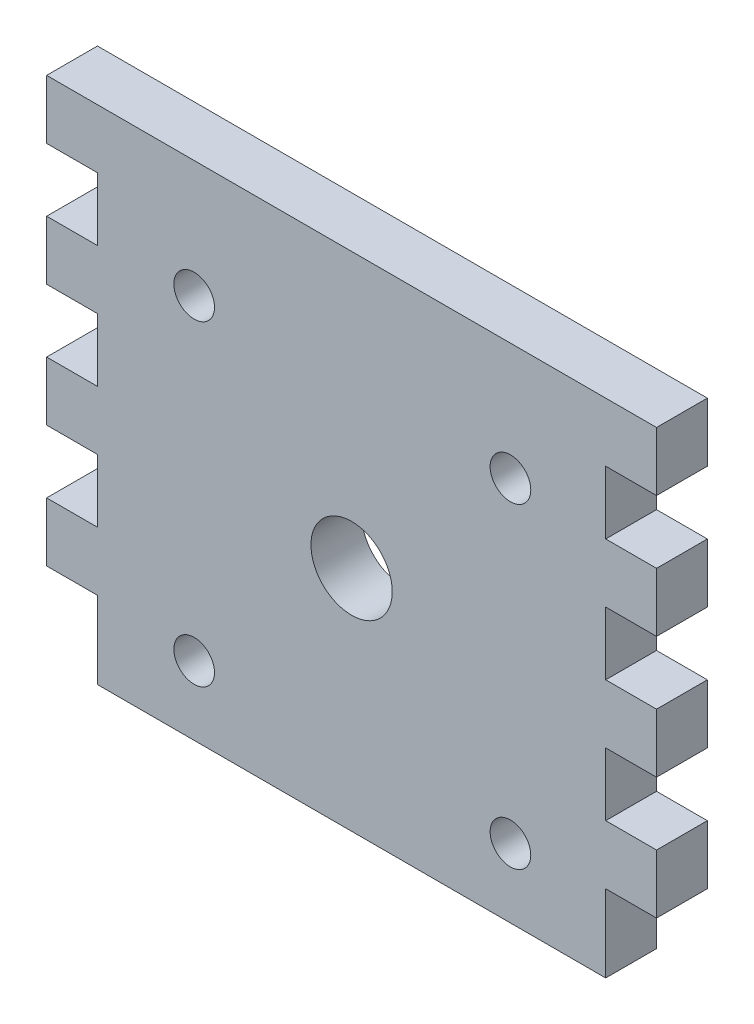
from build123d import *

# Parameters (mm, degrees)
SKETCH1_W           = 76.2
SKETCH1_H           = 76.2
BOSS_EXTRUDE1_DEPTH = 6.35
CUT_EXTRUDE1_DEPTH  = 6.35
SKETCH3_W           = 6.35
SKETCH3_H           = 38.1
CUT_EXTRUDE2_DEPTH  = 6.35
SKETCH4_W           = 6.35
SKETCH4_H           = 7.62
BOSS_EXTRUDE3_DEPTH = 6.35
SKETCH5_W           = 63.5
SKETCH5_H           = 6.35
CUT_EXTRUDE3_DEPTH  = 7.62
SKETCH6_R           = 5.08
SKETCH6_R_2         = 2.54
CUT_EXTRUDE4_DEPTH  = 71.769022866
SKETCH7_W           = 6.35
SKETCH7_H           = 7.62
BOSS_EXTRUDE4_DEPTH = 6.35
SKETCH9_W           = 63.5
SKETCH9_H           = 5.835909299
CUT_EXTRUDE5_DEPTH  = 6.35
SKETCH10_W          = 6.35
SKETCH10_H          = 6.35
BOSS_EXTRUDE5_DEPTH = 55.118
SKETCH11_W          = 6.35
SKETCH11_H          = 6.35
BOSS_EXTRUDE6_DEPTH = 55.118
CUT_EXTRUDE7_DEPTH  = 55.118
SKETCH13_W          = 6.35
SKETCH13_H          = 6.35
CUT_EXTRUDE8_DEPTH  = 55.118


with BuildPart() as part:
    # Sketch1 → Boss-Extrude1 (new body)
    with BuildSketch(Plane.XY):
        with Locations((0.21991342, -21.056709957)):
            Rectangle(SKETCH1_W, SKETCH1_H)
    extrude(amount=BOSS_EXTRUDE1_DEPTH)

    # Sketch2 → Cut-Extrude1 (cut)
    with BuildSketch(Plane.XY.offset(6.35)):
        Polygon((-37.88008658, 17.043290043), (-31.53008658, 17.043290043), (-31.53008658, 9.423290043), (-37.88008658, 9.423290043), (-37.88008658, 1.803290043), (-31.53008658, 1.803290043), (-31.53008658, -5.816709957), (-37.88008658, -5.816709957), (-37.88008658, -13.436709957), (-31.53008658, -13.436709957), (-31.53008658, -21.056709957), (-37.88008658, -21.056709957), (-46.725849744, -21.056709957), (-46.725849744, 17.043290043), align=None)
        Polygon((47.165676584, -21.056709957), (47.165676584, 17.043290043), (38.31991342, 17.043290043), (31.96991342, 17.043290043), (31.96991342, 9.423290043), (38.31991342, 9.423290043), (38.31991342, 1.803290043), (31.96991342, 1.803290043), (31.96991342, -5.816709957), (38.31991342, -5.816709957), (38.31991342, -13.436709957), (31.96991342, -13.436709957), (31.96991342, -21.056709957), (38.31991342, -21.056709957), align=None)
    extrude(amount=-CUT_EXTRUDE1_DEPTH, mode=Mode.SUBTRACT)

    # Sketch3 → Cut-Extrude2 (cut)
    with BuildSketch(Plane.XY.offset(6.35)):
        with Locations((-34.70508658, -40.106709957)):
            Rectangle(SKETCH3_W, SKETCH3_H)
        with Locations((35.14491342, -40.106709957)):
            Rectangle(SKETCH3_W, SKETCH3_H)
    extrude(amount=-CUT_EXTRUDE2_DEPTH, mode=Mode.SUBTRACT)

    # Sketch4 → Boss-Extrude3 (add)
    with BuildSketch(Plane.XY.offset(6.35)):
        with Locations((-34.70508658, -24.866709957)):
            Rectangle(SKETCH4_W, SKETCH4_H)
        with Locations((35.14491342, -24.866709957)):
            Rectangle(SKETCH4_W, SKETCH4_H)
    extrude(amount=-BOSS_EXTRUDE3_DEPTH)

    # Sketch5 → Cut-Extrude3 (cut)
    with BuildSketch(Plane(origin=(0, 17.043290043, 0), x_dir=(1, 0, 0), z_dir=(0, 1, 0))):
        with Locations((0.21991342, -3.175)):
            Rectangle(SKETCH5_W, SKETCH5_H)
    extrude(amount=-CUT_EXTRUDE3_DEPTH, mode=Mode.SUBTRACT)

    # Sketch6 → Cut-Extrude4 (cut, through all)
    with BuildSketch(Plane.XY.offset(6.35)):
        with Locations((0.21991342, -24.866709957)):
            Circle(SKETCH6_R)
        with Locations((-19.446847485, -5.199949052)):
            Circle(SKETCH6_R_2)
        with Locations((20.066279447, -5.199949052)):
            Circle(SKETCH6_R_2)
        with Locations((20.066279447, -44.713075984)):
            Circle(SKETCH6_R_2)
        with Locations((-19.446847485, -44.713075984)):
            Circle(SKETCH6_R_2)
    extrude(amount=-CUT_EXTRUDE4_DEPTH, mode=Mode.SUBTRACT)

    # Sketch7 → Boss-Extrude4 (add)
    with BuildSketch(Plane.XY.offset(6.35)):
        with Locations((-34.70508658, -40.106709957)):
            Rectangle(SKETCH7_W, SKETCH7_H)
        with Locations((35.14491342, -40.106709957)):
            Rectangle(SKETCH7_W, SKETCH7_H)
    extrude(amount=-BOSS_EXTRUDE4_DEPTH)

    # Sketch9 → Cut-Extrude5 (cut)
    with BuildSketch(Plane.XY.offset(6.35)):
        with Locations((0.21991342, -56.238755307)):
            Rectangle(SKETCH9_W, SKETCH9_H)
    extrude(amount=-CUT_EXTRUDE5_DEPTH, mode=Mode.SUBTRACT)

    # Sketch10 → Boss-Extrude5 (add)
    with BuildSketch(Plane.XZ.offset(-1.803290043)):
        with Locations((35.14491342, 3.175)):
            Rectangle(SKETCH10_W, SKETCH10_H)
    extrude(amount=BOSS_EXTRUDE5_DEPTH)

    # Sketch11 → Boss-Extrude6 (add)
    with BuildSketch(Plane.XZ.offset(-1.803290043)):
        with Locations((-34.70508658, 3.175)):
            Rectangle(SKETCH11_W, SKETCH11_H)
    extrude(amount=BOSS_EXTRUDE6_DEPTH)

    # Sketch12 → Cut-Extrude7 (cut)
    with BuildSketch(Plane.XY.offset(6.35)):
        Polygon((-37.88008658, 2.057290043), (-37.88008658, 9.423290043), (-56.012271814, 9.423290043), (-56.012271814, -53.817588834), (-37.88008658, -51.536709957), (-31.53008658, -51.536709957), (-31.53008658, -43.662709957), (-37.88008658, -43.662709957), (-37.88008658, -36.296709957), (-31.53008658, -36.296709957), (-31.53008658, -28.422709957), (-37.88008658, -28.422709957), (-37.88008658, -21.056709957), (-31.53008658, -21.056709957), (-31.53008658, -13.182709957), (-37.88008658, -13.182709957), (-37.88008658, -5.816709957), (-31.53008658, -5.816709957), (-31.53008658, 2.057290043), align=None)
        Polygon((56.452098653, -53.817588834), (56.452098653, 9.423290043), (38.31991342, 9.423290043), (38.31991342, 2.057290043), (31.96991342, 2.057290043), (31.96991342, -5.816709957), (38.31991342, -5.816709957), (38.31991342, -13.182709957), (31.96991342, -13.182709957), (31.96991342, -21.056709957), (38.31991342, -21.056709957), (38.31991342, -28.422709957), (31.96991342, -28.422709957), (31.96991342, -36.296709957), (38.31991342, -36.296709957), (38.31991342, -43.662709957), (31.96991342, -43.662709957), (31.96991342, -51.536709957), (38.31991342, -51.536709957), align=None)
    extrude(amount=-CUT_EXTRUDE7_DEPTH, mode=Mode.SUBTRACT)

    # Sketch13 → Cut-Extrude8 (cut)
    with BuildSketch(Plane(origin=(0, -51.536709957, 0), x_dir=(1, 0, 0), z_dir=(0, 1, 0))):
        with Locations((-34.70508658, -3.175)):
            Rectangle(SKETCH13_W, SKETCH13_H)
        with Locations((35.14491342, -3.175)):
            Rectangle(SKETCH13_W, SKETCH13_H)
    extrude(amount=-CUT_EXTRUDE8_DEPTH, mode=Mode.SUBTRACT)


solid = part.part
